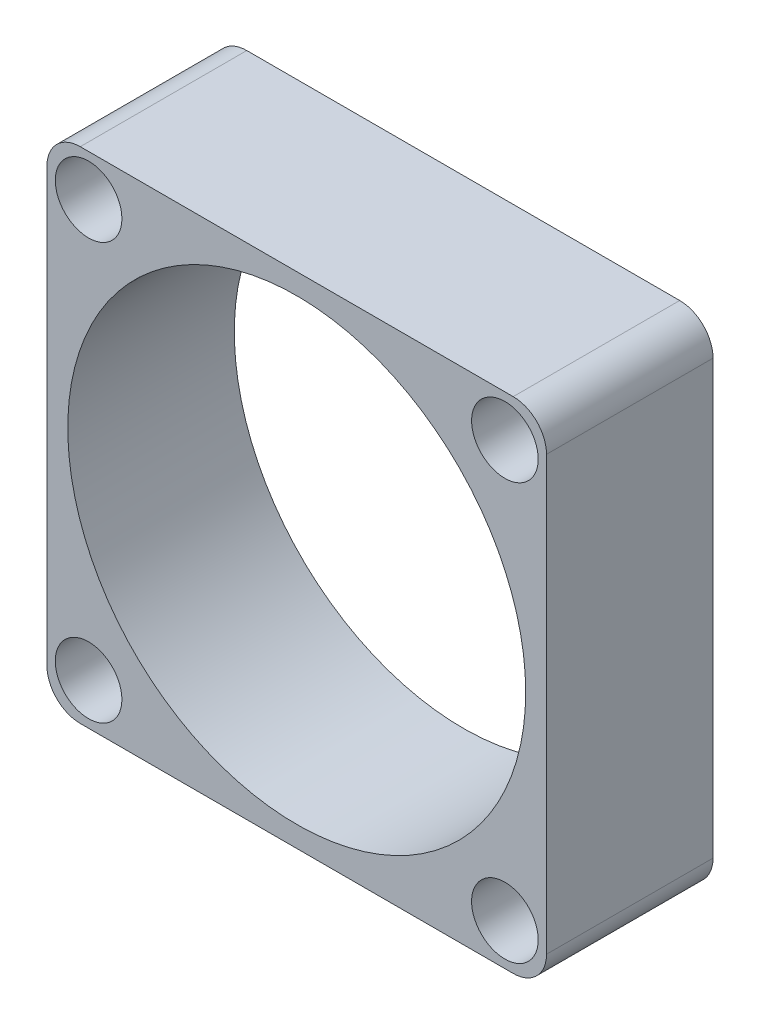
from build123d import *

# Parameters (mm, degrees)
SKETCH1_W           = 30
SKETCH1_H           = 30
BOSS_EXTRUDE1_DEPTH = 10
SKETCH3_R           = 13.75
SKETCH3_R_2         = 2
CUT_EXTRUDE1_DEPTH  = 10
FILLET1_R           = 2


with BuildPart() as part:
    # Sketch1 → Boss-Extrude1 (new body)
    with BuildSketch(Plane.XY):
        with Locations((15, 15)):
            Rectangle(SKETCH1_W, SKETCH1_H)
    extrude(amount=BOSS_EXTRUDE1_DEPTH)

    # Sketch3 → Cut-Extrude1 (cut)
    with BuildSketch(Plane.XY.offset(10)):
        with Locations((15, 15)):
            Circle(SKETCH3_R)
        with Locations((2.5, 27.5)):
            Circle(SKETCH3_R_2)
        with Locations((27.5, 27.5)):
            Circle(SKETCH3_R_2)
        with Locations((27.5, 2.5)):
            Circle(SKETCH3_R_2)
        with Locations((2.5, 2.5)):
            Circle(SKETCH3_R_2)
    extrude(amount=-CUT_EXTRUDE1_DEPTH, mode=Mode.SUBTRACT)

    # Fillet1
    fillet1_edges = [part.edges().sort_by_distance(p)[0] for p in [
        (0, 0, 5),
        (30, 0, 5),
        (0, 30, 5),
        (30, 30, 5),
    ]]
    fillet(fillet1_edges, radius=FILLET1_R)


solid = part.part
